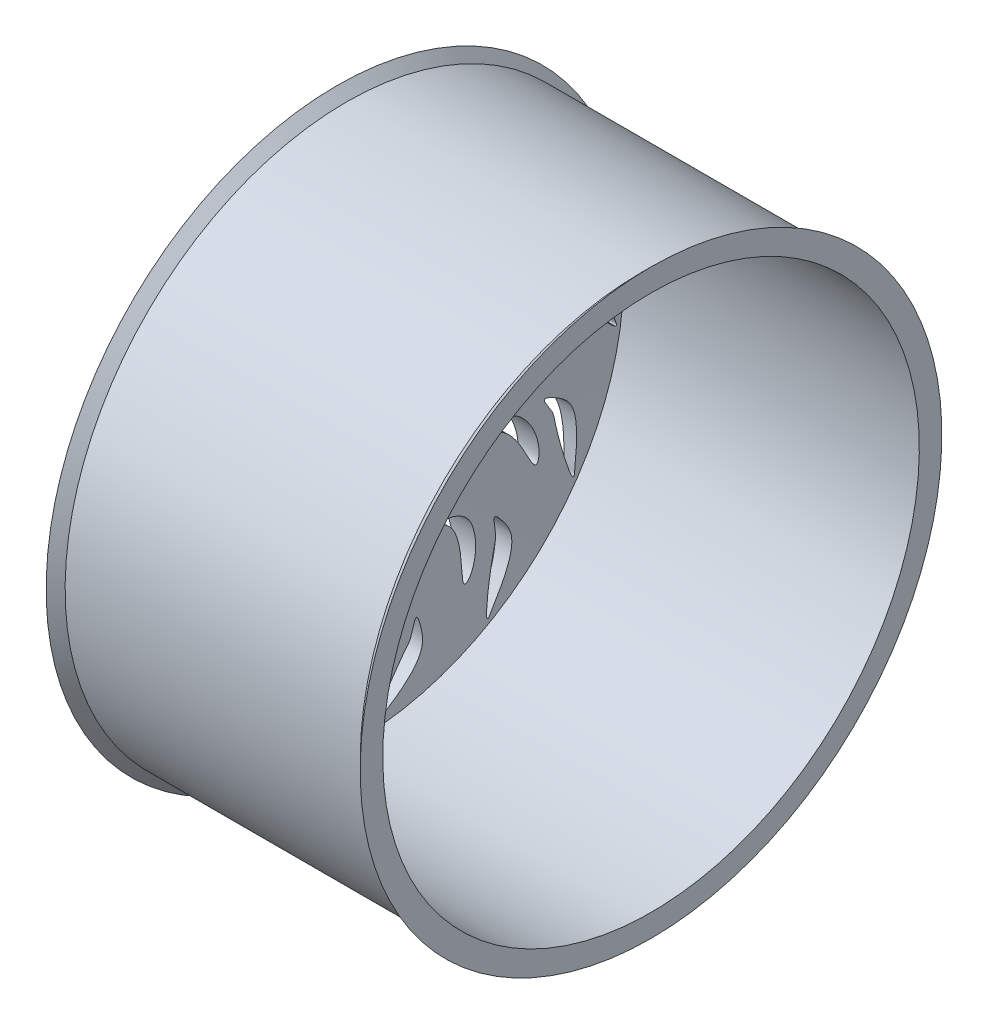
from build123d import *

# Parameters (mm, degrees)
SKETCH3_R          = 44.621431925
SKETCH3_R_2        = 25.4
CUT_EXTRUDE3_DEPTH = 25.4
CUT_EXTRUDE3_TAPER = 29
CUT_EXTRUDE4_DEPTH = 413.831803211
CIRPATTERN1_COUNT  = 14
SKETCH5_R          = 12.7
CUT_EXTRUDE5_DEPTH = 381.688519416


with BuildPart() as part:
    # Sketch2 → Revolve1 (revolve)
    with BuildSketch(Plane.XY):
        with BuildLine():
            Line((-63.5, 0), (104.14, 0))
            Line((104.14, 0), (109.528153673, 5.388153673))
            Line((109.528153673, 5.388153673), (109.528153673, -7.414049459))
            Line((109.528153673, -7.414049459), (-58.467295467, -7.414049459))
            Line((-58.467295467, -7.414049459), (-68.888153673, -159.814049459))
            Line((-68.888153673, -159.814049459), (-75.228882552, -159.814049459))
            add(Edge.make_bspline(
                [(-63.5, -7.414049459), (-97.600356169, -104.397259936), (-75.228882552, -159.814049459)],
                knots=[0, 0, 0, 0.818433762, 0.818433762, 0.818433762], degree=2))
            Line((-63.5, -7.414049459), (-68.888153673, -5.388153673))
            Line((-68.888153673, -5.388153673), (-68.888153673, 5.388153673))
            Line((-68.888153673, 5.388153673), (-63.5, 0))
        make_face()
    revolve(axis=Axis((106.498634669, -159.814049459, 0), (-1, 0, 0)))

    # Sketch3 → Cut-Extrude3 (cut)
    with BuildSketch(Plane.ZY.offset(84.128153673)):
        with Locations((0, -159.814049459)):
            Circle(SKETCH3_R)
        with Locations((0, -159.814049459)):
            Circle(SKETCH3_R_2, mode=Mode.SUBTRACT)
    extrude(amount=-CUT_EXTRUDE3_DEPTH, taper=CUT_EXTRUDE3_TAPER, mode=Mode.SUBTRACT)

    # Sketch4 → Cut-Extrude4 (cut, through all)
    with BuildSketch(Plane.ZY.offset(84.128153673)):
        with BuildLine():
            add(Edge.make_bspline(
                [(14.10217472, -11.372955392), (4.829839269, -4.754186134), (25.556609347, -32.051298221), (35.008498563, -41.764734585), (37.354034277, -56.658228392), (41.840549537, -26.40273381), (17.23709624, -13.705730068), (14.391775126, -11.579677665), (14.10217472, -11.372955392)],
                knots=[0, 0, 0, 0, 0.536214958, 0.619467498, 0.808852298, 0.849272858, 0.98325254, 1, 1, 1, 1], degree=3))
        make_face()
        with BuildLine():
            add(Edge.make_bspline(
                [(26.801746263, -55.029717929), (24.525692503, -40.728308923), (-2.365109234, -23.299194261), (24.021762407, -56.852379378), (13.255473702, -73.782062969), (28.06710408, -66.138952339), (26.957981874, -56.011412393), (26.801746263, -55.029717929)],
                knots=[0, 0, 0, 0, 0.326477905, 0.738062618, 0.775895122, 0.977589512, 1, 1, 1, 1], degree=3))
        make_face()
        with BuildLine():
            add(Edge.make_bspline(
                [(10.908716136, -74.770609861), (22.900625736, -96.97502272), (15.712703275, -116.698590841)],
                knots=[0, 0, 0, 0.477784597, 0.477784597, 0.477784597], degree=2))
            add(Edge.make_bspline(
                [(15.712703275, -116.698590841), (45.144522908, -89.230351206), (10.908716136, -74.770609861)],
                knots=[0, 0, 0, 1, 1, 1], degree=2))
        make_face()
    cut_extrude4 = extrude(amount=-CUT_EXTRUDE4_DEPTH, mode=Mode.SUBTRACT)

    # CirPattern1: Cut-Extrude4 ×14 about axis
    cirpattern1_axis = Axis((-84.128153673, -159.814049459, 0), (-1, 0, 0))
    for i in range(1, CIRPATTERN1_COUNT):
        add(cut_extrude4.rotate(cirpattern1_axis, i * 360 / CIRPATTERN1_COUNT), mode=Mode.SUBTRACT)

    # Sketch5 → Cut-Extrude5 (cut, through all)
    with BuildSketch(Plane(origin=(0, 0, 0), x_dir=(0, 0, -1), z_dir=(1, 0, 0))):
        with Locations(Location((0, -159.814049459, 0), (0, 0, 90))):
            Circle(SKETCH5_R)
    extrude(amount=-CUT_EXTRUDE5_DEPTH, mode=Mode.SUBTRACT)


solid = part.part
